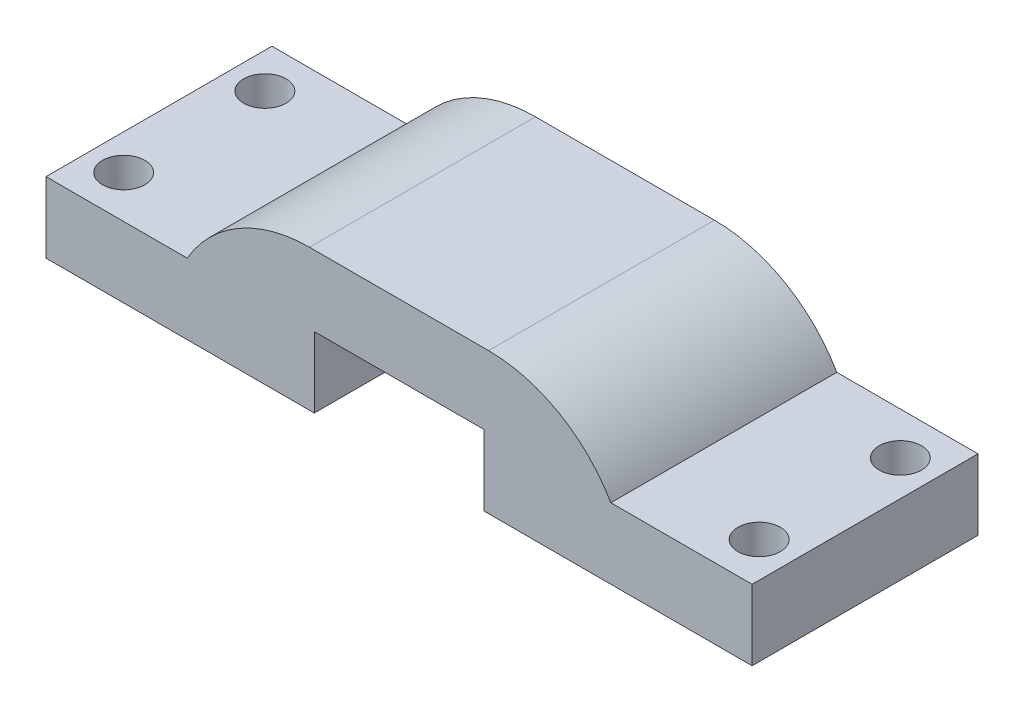
from build123d import *

# Parameters (mm, degrees)
BOSS_EXTRUDE1_DEPTH = 16
SKETCH14_R          = 1.5
CUT_EXTRUDE13_DEPTH = 50
FILLET1_R           = 10


with BuildPart() as part:
    # Sketch7 → Boss-Extrude1 (new body)
    with BuildSketch(Plane.XY):
        Polygon((9.868798372, -27.16601268), (9.868798372, -22.16601268), (-2.131201628, -22.16601268), (-2.131201628, -27.16601268), (-8.131201628, -27.16601268), (-21.131201628, -27.16601268), (-21.131201628, -22.16601268), (-11.131201628, -22.16601268), (-11.131201628, -17.16601268), (18.868798372, -17.16601268), (18.868798372, -22.16601268), (28.868798372, -22.16601268), (28.868798372, -27.16601268), (15.868798372, -27.16601268), align=None)
    extrude(amount=BOSS_EXTRUDE1_DEPTH)

    # Sketch14 → Cut-Extrude13 (cut)
    with BuildSketch(Plane(origin=(0, -27.16601268, 0), x_dir=(1, 0, 0), z_dir=(0, 1, 0))):
        with Locations(Location((-18.631201628, -3, 0), (0, 0, 90))):
            Circle(SKETCH14_R)
        with Locations(Location((-18.631201628, -13, 0), (0, 0, 90))):
            Circle(SKETCH14_R)
        with Locations(Location((26.368798372, -3, 0), (0, 0, 270))):
            Circle(SKETCH14_R)
        with Locations(Location((26.368798372, -13, 0), (0, 0, 270))):
            Circle(SKETCH14_R)
    extrude(amount=CUT_EXTRUDE13_DEPTH, mode=Mode.SUBTRACT)

    # Fillet1
    # the kernel refuses this fillet: 10 mm, written as the material it takes off along each edge
    with BuildSketch(Plane(origin=(-11.131201628, -17.16601268, -21.650635095), x_dir=(0, -1, 0), z_dir=(0, 0, 1))) as fillet1_piece_1:
        with BuildLine():
            CenterArc((10, 8.660254038), FILLET1_R, 180, 60)
            Line((0, 8.660254038), (-0.2, 8.660254038))
            Line((-0.2, 8.660254038), (-0.2, 0))
            Line((-0.2, 0), (0, -0.2))
            ThreePointArc((0, -0.2), (2.5, -0.2), (4.9, -0.173205081))
            Line((4.9, -0.173205081), (5, 0))
        make_face()
    extrude(amount=59.301270189, mode=Mode.SUBTRACT)
    with BuildSketch(Plane(origin=(18.868798372, -17.16601268, -21.650635095), x_dir=(-1, 0, 0), z_dir=(0, 0, 1))) as fillet1_piece_2:
        with BuildLine():
            CenterArc((8.660254038, 10), FILLET1_R, 210, 60)
            Line((0, 5), (-0.173205081, 4.9))
            ThreePointArc((-0.173205081, 4.9), (-0.2, 2.5), (-0.2, 0))
            Line((-0.2, 0), (0, -0.2))
            Line((0, -0.2), (8.660254038, -0.2))
            Line((8.660254038, -0.2), (8.660254038, 0))
        make_face()
    extrude(amount=59.301270189, mode=Mode.SUBTRACT)


solid = part.part
